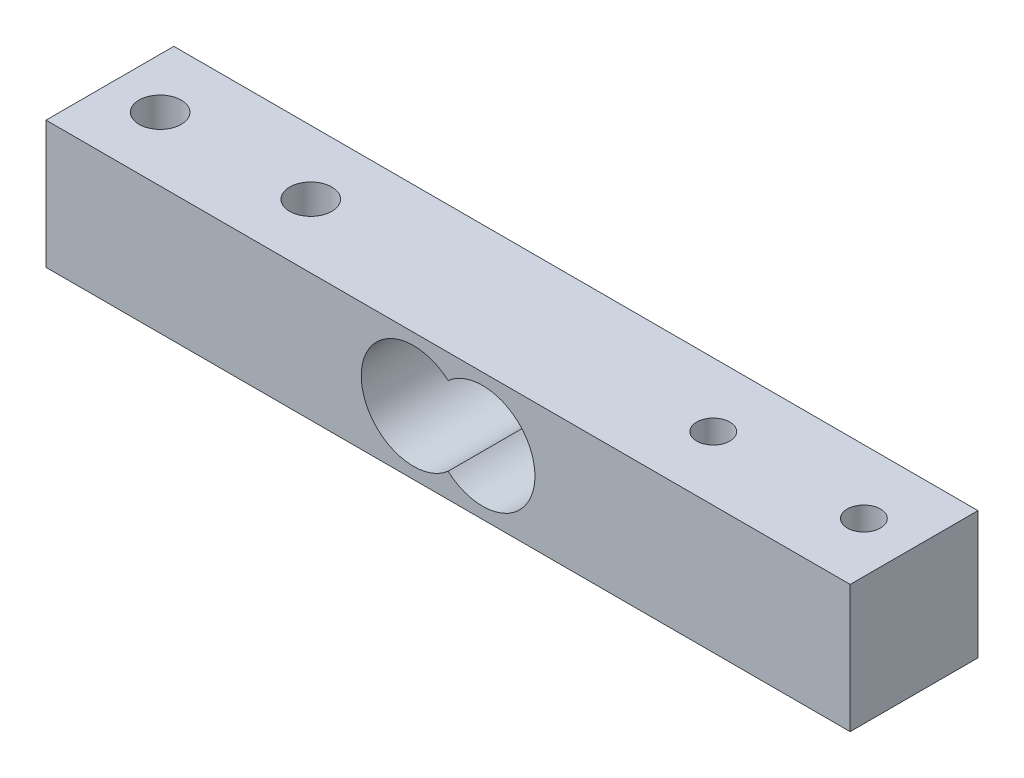
from build123d import *

# Parameters (mm, degrees)
SKETCH1_W             = 80.08
SKETCH1_H             = 12.7
BOSS_EXTRUDE1_DEPTH   = 12.73
M5X0_8_TAPPED_HOLE1_D = 4.2
M4X0_7_TAPPED_HOLE1_D = 3.3
CUT_EXTRUDE1_DEPTH    = 12.73


with BuildPart() as part:
    # Sketch1 → Boss-Extrude1 (new body)
    with BuildSketch(Plane.XY):
        Rectangle(SKETCH1_W, SKETCH1_H)
    extrude(amount=BOSS_EXTRUDE1_DEPTH)

    # M5x0.8 Tapped Hole1 (through all)
    with Locations(Plane(origin=(0, 6.35, 0), x_dir=(1, 0, 0), z_dir=(0, 1, 0))):
        with Locations((-35.04, -6.365), (-20.04, -6.365)):
            Hole(M5X0_8_TAPPED_HOLE1_D / 2)

    # M4x0.7 Tapped Hole1 (through all)
    with Locations(Plane(origin=(0, 6.35, 0), x_dir=(1, 0, 0), z_dir=(0, 1, 0))):
        with Locations((20.04, -6.365), (35.04, -6.365)):
            Hole(M4X0_7_TAPPED_HOLE1_D / 2)

    # Sketch7 → Cut-Extrude1 (cut)
    with BuildSketch(Plane.XY.offset(12.73)):
        with BuildLine():
            ThreePointArc((0, -3.912863402), (8.65, 0), (0, 3.912863402))
            ThreePointArc((0, 3.912863402), (-8.65, 0), (0, -3.912863402))
        make_face()
    extrude(amount=-CUT_EXTRUDE1_DEPTH, mode=Mode.SUBTRACT)


solid = part.part
